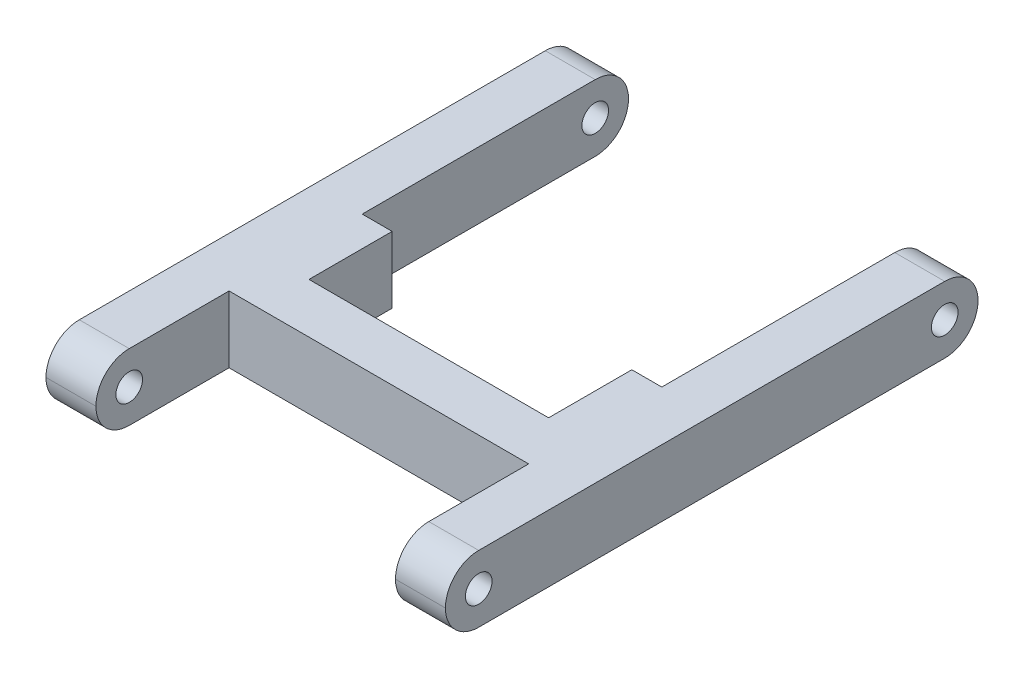
from build123d import *

# Parameters (mm, degrees)
SKETCH1_W           = 60
SKETCH1_H           = 80
BOSS_EXTRUDE1_DEPTH = 10
SKETCH3_W           = 45
SKETCH3_H           = 40
CUT_EXTRUDE1_DEPTH  = 51.990195136
SKETCH4_W           = 45
SKETCH4_H           = 20
CUT_EXTRUDE2_DEPTH  = 51.990195136
SKETCH5_R           = 2
CUT_EXTRUDE3_DEPTH  = 73.801098893
FILLET1_R           = 5
SKETCH6_W           = 36
SKETCH6_H           = 25
CUT_EXTRUDE4_DEPTH  = 51.990195136


with BuildPart() as part:
    # Sketch1 → Boss-Extrude1 (new body)
    with BuildSketch(Plane(origin=(0, 0, 0), x_dir=(1, 0, 0), z_dir=(0, 1, 0))):
        Rectangle(SKETCH1_W, SKETCH1_H)
    extrude(amount=BOSS_EXTRUDE1_DEPTH)

    # Sketch3 → Cut-Extrude1 (cut, through all)
    with BuildSketch(Plane(origin=(0, 10, 0), x_dir=(1, 0, 0), z_dir=(0, 1, 0))):
        with Locations((0, 20)):
            Rectangle(SKETCH3_W, SKETCH3_H)
    extrude(amount=-CUT_EXTRUDE1_DEPTH, mode=Mode.SUBTRACT)

    # Sketch4 → Cut-Extrude2 (cut, through all)
    with BuildSketch(Plane(origin=(0, 10, 0), x_dir=(1, 0, 0), z_dir=(0, 1, 0))):
        with Locations((0, -30)):
            Rectangle(SKETCH4_W, SKETCH4_H)
    extrude(amount=-CUT_EXTRUDE2_DEPTH, mode=Mode.SUBTRACT)

    # Sketch5 → Cut-Extrude3 (cut, through all)
    with BuildSketch(Plane.ZY.offset(30)):
        with Locations((35, 5)):
            Circle(SKETCH5_R)
        with Locations((-35, 5)):
            Circle(SKETCH5_R)
    extrude(amount=-CUT_EXTRUDE3_DEPTH, mode=Mode.SUBTRACT)

    # Fillet1
    fillet1_edges = [part.edges().sort_by_distance(p)[0] for p in [
        (26.25, 0, 40),
        (-26.25, 0, 40),
        (-26.25, 0, -40),
        (26.25, 0, -40),
        (-26.25, 10, -40),
        (-26.25, 10, 40),
        (26.25, 10, 40),
        (26.25, 10, -40),
    ]]
    fillet(fillet1_edges, radius=FILLET1_R - 0.0001)  # a hair under: the kernel refuses the full size

    # Sketch6 → Cut-Extrude4 (cut, through all)
    with BuildSketch(Plane(origin=(0, 10, 0), x_dir=(1, 0, 0), z_dir=(0, 1, 0))):
        Rectangle(SKETCH6_W, SKETCH6_H)
    extrude(amount=-CUT_EXTRUDE4_DEPTH, mode=Mode.SUBTRACT)


solid = part.part
